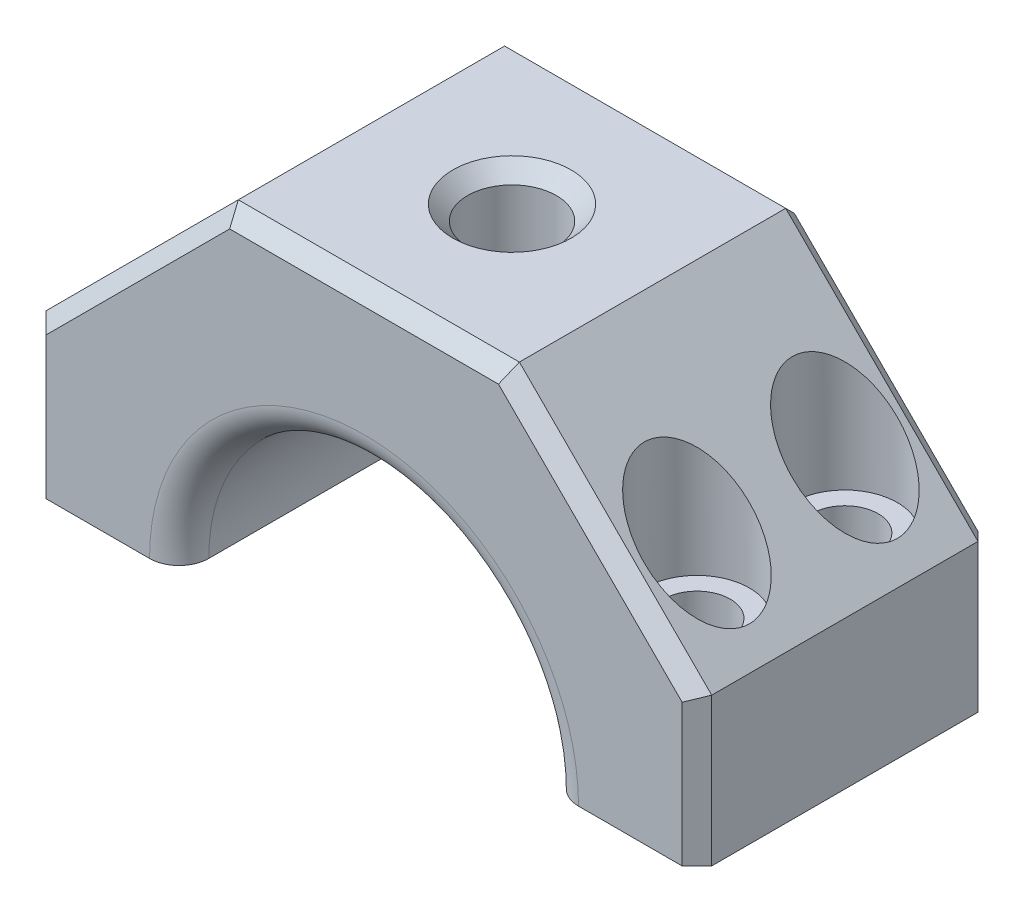
from build123d import *

# Parameters (mm, degrees)
BOSS_EXTRUDE1_DEPTH     = 23
CUT_EXTRUDE1_REACH      = 39.885
CUT_EXTRUDE2_REACH      = 35.693
SKETCH3_R               = 2.25
CUT_EXTRUDE3_START      = 23
SKETCH4_R               = 3.55
CUT_EXTRUDE3_DEPTH      = 13
FILLET1_R               = 2
CHAMFER1_SIZE           = 13
CHAMFER2_SIZE           = 1
CUT_EXTRUDE4_REACH      = 35.693
CUT_EXTRUDE4_END_RADIUS = 12.5
SKETCH5_R               = 3
CHAMFER3_SIZE           = 1


with BuildPart() as part:
    # Sketch1 → Boss-Extrude1 (new body)
    with BuildSketch(Plane(origin=(0, 0, 0), x_dir=(1, 0, 0), z_dir=(0, 1, 0))):
        Polygon((0, 10), (-22.5, 10), (-22.5, -10), (22.5, -10), (22.5, 10), align=None)
    extrude(amount=BOSS_EXTRUDE1_DEPTH)

    # Sketch2 → Cut-Extrude1 (cut, up to next)
    with BuildSketch(Plane.XY.offset(10), mode=Mode.PRIVATE) as cut_extrude1_sk1:
        with BuildLine():
            Line((-12.5, 0), (-22.5, 0))
            Line((-22.5, 0), (-22.5, -2.522641864))
            Line((-22.5, -2.522641864), (22.5, -2.522641864))
            Line((22.5, -2.522641864), (22.5, 0))
            Line((22.5, 0), (12.5, 0))
            ThreePointArc((12.5, 0), (0, 12.5), (-12.5, 0))
        make_face()
    cut_extrude1_tool1 = extrude(cut_extrude1_sk1.sketch, amount=-CUT_EXTRUDE1_REACH, mode=Mode.PRIVATE) & part.part
    add(cut_extrude1_tool1.solids().sort_by_distance((0, 3.22853, 10))[0], mode=Mode.SUBTRACT)

    # Sketch3 → Cut-Extrude2 (cut, up to next)
    with BuildSketch(Plane(origin=(0, 0, 0), x_dir=(1, 0, 0), z_dir=(0, 1, 0)), mode=Mode.PRIVATE) as cut_extrude2_sk1:
        with Locations(Location((-17.5, -5, 0), (0, 0, 270))):
            Circle(SKETCH3_R)
    cut_extrude2_tool1 = extrude(cut_extrude2_sk1.sketch, amount=CUT_EXTRUDE2_REACH, mode=Mode.PRIVATE) & part.part
    # Sketch3 → Cut-Extrude2 (cut, up to next)
    with BuildSketch(Plane(origin=(0, 0, 0), x_dir=(1, 0, 0), z_dir=(0, 1, 0)), mode=Mode.PRIVATE) as cut_extrude2_sk2:
        with Locations(Location((-17.5, 5, 0), (0, 0, 270))):
            Circle(SKETCH3_R)
    cut_extrude2_tool2 = extrude(cut_extrude2_sk2.sketch, amount=CUT_EXTRUDE2_REACH, mode=Mode.PRIVATE) & part.part
    cut_extrude2_1 = cut_extrude2_tool1.solids().sort_by_distance((-17.5, 0, 5))[0]
    add(cut_extrude2_1, mode=Mode.SUBTRACT)
    cut_extrude2_2 = cut_extrude2_tool2.solids().sort_by_distance((-17.5, 0, -5))[0]
    add(cut_extrude2_2, mode=Mode.SUBTRACT)
    cut_extrude2 = cut_extrude2_1 + cut_extrude2_2  # Cut-Extrude2 as one shape, for the pattern or mirror that repeats it

    # Mirror1: Cut-Extrude2 across plane
    add(cut_extrude2.mirror(Plane(origin=(0, 0, 0), x_dir=(0, 0, 1), z_dir=(1, 0, 0))), mode=Mode.SUBTRACT)

    # Sketch4 → Cut-Extrude3 (cut)
    with BuildSketch(Plane(origin=(0, 0, 0), x_dir=(1, 0, 0), z_dir=(0, 1, 0)).offset(CUT_EXTRUDE3_START)):
        with Locations(Location((-17.5, 5, 0), (0, 0, 270))):
            Circle(SKETCH4_R)
        with Locations(Location((-17.5, -5, 0), (0, 0, 270))):
            Circle(SKETCH4_R)
    cut_extrude3 = extrude(amount=-CUT_EXTRUDE3_DEPTH, mode=Mode.SUBTRACT)

    # Mirror2: Cut-Extrude3 across plane
    add(cut_extrude3.mirror(Plane(origin=(0, 0, 0), x_dir=(0, 0, 1), z_dir=(1, 0, 0))), mode=Mode.SUBTRACT)

    # Fillet1
    fillet1_edges = [part.edges().sort_by_distance(p)[0] for p in [
        (0, 12.5, 10),
        (0, 12.5, -10),
    ]]
    fillet(fillet1_edges, radius=FILLET1_R)

    # Chamfer1
    # the kernel refuses this chamfer: 13 mm, written as the material it takes off along each edge
    with BuildSketch(Plane(origin=(-22.5, 23, -43.431878844), x_dir=(0.9996219169112968, 0.027495876610586424, 0), z_dir=(0, 0, 1))) as chamfer1_piece_1:
        Polygon((CHAMFER1_SIZE * 0.999621916911, -CHAMFER1_SIZE * 0.0274958766106), (-CHAMFER1_SIZE * 0.0274958766106, -CHAMFER1_SIZE * 0.999621916911), (0, 0), align=None)
    extrude(amount=86.863757687, mode=Mode.SUBTRACT)
    with BuildSketch(Plane(origin=(22.5, 23, 43.431878844), x_dir=(0.027495876610586424, -0.9996219169112968, 0), z_dir=(0, 0, -1))) as chamfer1_piece_2:
        Polygon((CHAMFER1_SIZE * 0.999621916911, CHAMFER1_SIZE * 0.0274958766106), (-CHAMFER1_SIZE * 0.0274958766106, CHAMFER1_SIZE * 0.999621916911), (0, 0), align=None)
    extrude(amount=86.863757687, mode=Mode.SUBTRACT)

    # Chamfer2
    chamfer2_edges = [part.edges().sort_by_distance(p)[0] for p in [
        (0, 23, -10),
        (0, 23, 10),
        (-22.5, 5, -10),
        (22.5, 5, -10),
        (-16, 16.5, -10),
        (16, 16.5, -10),
        (22.5, 5, 10),
        (-22.5, 5, 10),
        (-16, 16.5, 10),
        (16, 16.5, 10),
    ]]
    chamfer(chamfer2_edges, length=CHAMFER2_SIZE)

    # Cut-Extrude4: up to this cylinder (the profile starts outside it)
    cut_extrude4_end = Plane(origin=(0, 0, 0), z_dir=(0, 0, 1)) * Cylinder(CUT_EXTRUDE4_END_RADIUS, 97.386, mode=Mode.PRIVATE)
    # Sketch5 → Cut-Extrude4 (cut, up to the surface)
    with BuildSketch(Plane(origin=(0, 23, 0), x_dir=(1, 0, 0), z_dir=(0, 1, 0)), mode=Mode.PRIVATE) as cut_extrude4_sk1:
        with Locations(Location((0, 0, 0), (0, 0, 270))):
            Circle(SKETCH5_R)
    cut_extrude4_tool1 = extrude(cut_extrude4_sk1.sketch, amount=-CUT_EXTRUDE4_REACH, mode=Mode.PRIVATE) - cut_extrude4_end
    add(cut_extrude4_tool1.solids().sort_by_distance((0, 23, 0))[0], mode=Mode.SUBTRACT)

    # Chamfer3
    chamfer3_edges = [part.edges().sort_by_distance(p)[0] for p in [
        (0, 23, -3),
    ]]
    chamfer(chamfer3_edges, length=CHAMFER3_SIZE)


solid = part.part
